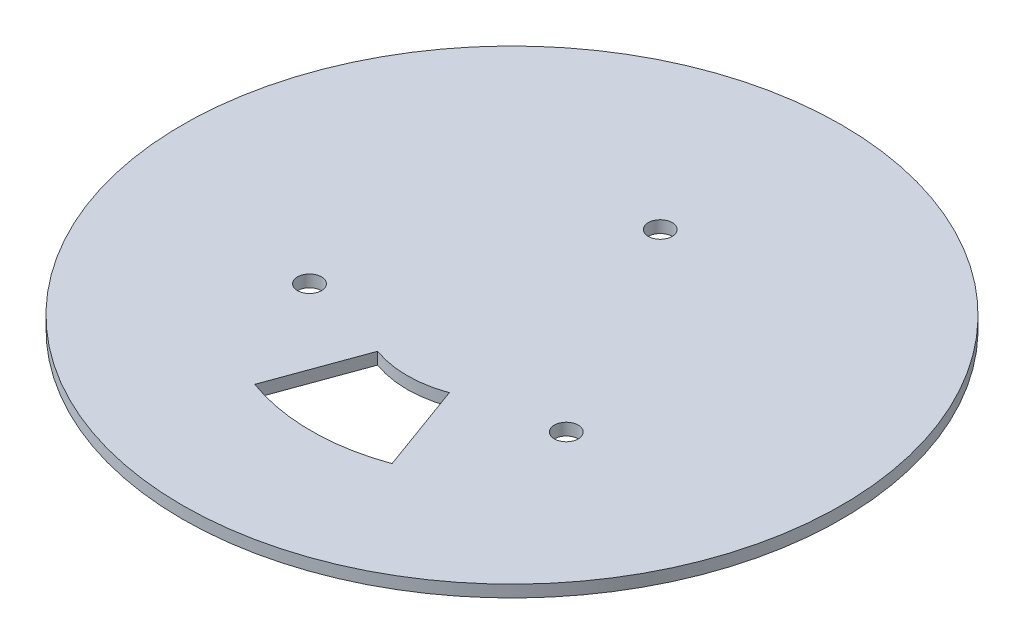
from build123d import *

# Parameters (mm, degrees)
ESBO_O1_R                = 110
RESSALTO_EXTRUS_O1_DEPTH = 4
CORTE_EXTRUS_O1_DEPTH    = 156.614909311
ESBO_O3_R                = 4
CORTE_EXTRUS_O2_DEPTH    = 156.614909311


with BuildPart() as part:
    # Esboço1 → Ressalto-extrusão1 (new body)
    with BuildSketch(Plane(origin=(0, 0, 0), x_dir=(1, 0, 0), z_dir=(0, 1, 0))):
        Circle(ESBO_O1_R)
    extrude(amount=RESSALTO_EXTRUS_O1_DEPTH)

    # Esboço2 → Corte-extrusão1 (cut, through all)
    with BuildSketch(Plane(origin=(0, 4, 0), x_dir=(1, 0, 0), z_dir=(0, 1, 0))):
        with BuildLine():
            Line((-11.970705016, -32.889241728), (-22.915349603, -62.959405593))
            ThreePointArc((-22.915349603, -62.959405593), (0, -67), (22.915349603, -62.959405593))
            Line((22.915349603, -62.959405593), (11.970705016, -32.889241728))
            ThreePointArc((11.970705016, -32.889241728), (0, -35), (-11.970705016, -32.889241728))
        make_face()
    extrude(amount=-CORTE_EXTRUS_O1_DEPTH, mode=Mode.SUBTRACT)

    # Esboço3 → Corte-extrusão2 (cut, through all)
    with BuildSketch(Plane(origin=(0, 4, 0), x_dir=(1, 0, 0), z_dir=(0, 1, 0))):
        with Locations((42.850936979, -24.74)):
            Circle(ESBO_O3_R)
        with Locations((0, 49.48)):
            Circle(ESBO_O3_R)
        with Locations((-42.850936979, -24.74)):
            Circle(ESBO_O3_R)
    extrude(amount=-CORTE_EXTRUS_O2_DEPTH, mode=Mode.SUBTRACT)


solid = part.part
